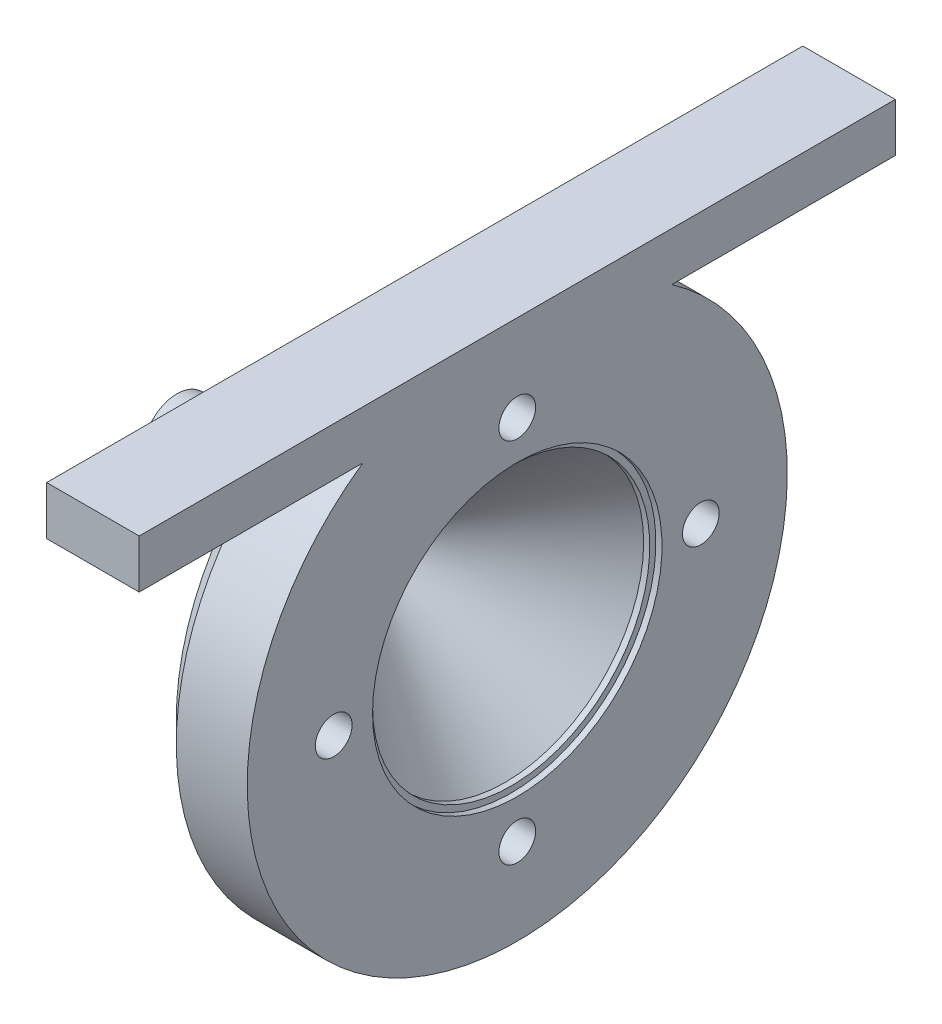
from build123d import *

# Parameters (mm, degrees)
M3_CLEARANCE_HOLE1_D     = 3.4
M3_CLEARANCE_HOLE1_DEPTH = 8.566
M3_CLEARANCE_HOLE1_TIP   = 1.021463052
CHAMFER1_SIZE            = 2
SKETCH1_11_W             = 8.566
SKETCH1_11_H             = 4.5
BOSS_EXTRUDE1_DEPTH      = 35


with BuildPart() as part:
    # Sketch1 → Revolve17 (revolve)
    with BuildSketch(Plane.XY):
        Polygon((-14.010170791, 3.8), (-14.010170791, 3.15), (-9.676837458, 3.8), (-9.676837458, 3.15), (-5.343504124, 3.8), (4.596253634, 12.834), (4.596253634, 25), (13.162253634, 25), (13.162253634, 13.4), (12.596253634, 13.4), (12.596253634, 12.834), (12.030253634, 12.834), (0, 1.9), (-18.343504124, 1.9), (-18.343504124, 3.15), align=None)
    revolve(axis=Axis((-801.920554309, 0, 0), (1, 0, 0)))

    # M3 Clearance Hole1
    with Locations(Plane.ZY.offset(-4.596253634)):
        with Locations((0, -16.994664238), (0, 16.994664238), (16.994664238, 0), (-16.994664238, 0)):
            Hole(M3_CLEARANCE_HOLE1_D / 2, depth=M3_CLEARANCE_HOLE1_DEPTH)
            with Locations((0, 0, -(M3_CLEARANCE_HOLE1_DEPTH + M3_CLEARANCE_HOLE1_TIP / 2))):  # 118° drill point
                Cone(0, M3_CLEARANCE_HOLE1_D / 2, M3_CLEARANCE_HOLE1_TIP, mode=Mode.SUBTRACT)

    # Chamfer1
    chamfer1_edges = [part.edges().sort_by_distance(p)[0] for p in [
        (4.596253634, -25, 0),
    ]]
    chamfer(chamfer1_edges, length=CHAMFER1_SIZE)

    # Sketch1<11> → Boss-Extrude1 (add, symmetric)
    with BuildSketch(Plane.XY):
        with Locations((8.879253634, 22.75)):
            Rectangle(SKETCH1_11_W, SKETCH1_11_H)
    extrude(amount=BOSS_EXTRUDE1_DEPTH, both=True)


solid = part.part
